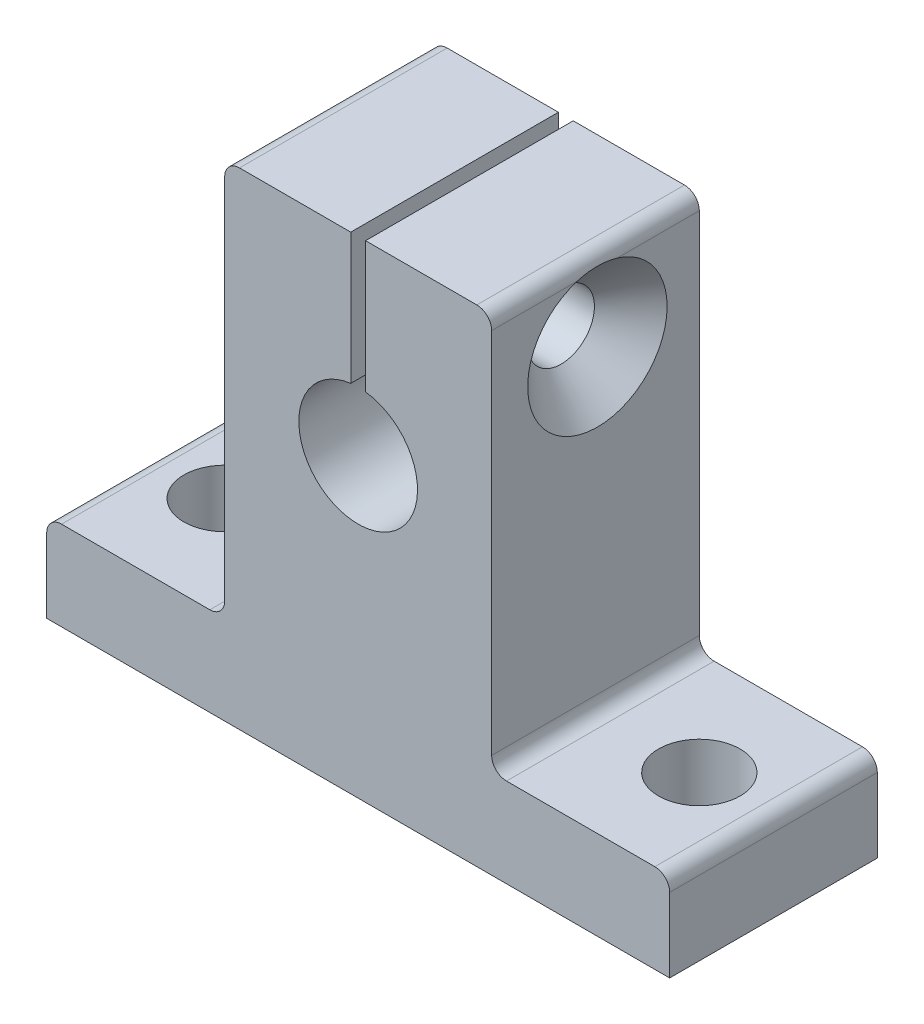
from build123d import *

# Parameters (mm, degrees)
BOSS_EXTRUDE1_DEPTH                             = 14
F_5_5_5_5_DIAMETER_HOLE1_D                      = 5.5
CSK_FOR_M4_FLAT_HEAD_MACHINE_SCREW1_D           = 4.5
CSK_FOR_M4_FLAT_HEAD_MACHINE_SCREW1_CSINK_D     = 9.4
CSK_FOR_M4_FLAT_HEAD_MACHINE_SCREW1_CSINK_ANGLE = 90
FILLET1_R                                       = 1


with BuildPart() as part:
    # Sketch1 → Boss-Extrude1 (new body)
    with BuildSketch(Plane.XY):
        with BuildLine():
            Line((-21, 0), (21, 0))
            Line((21, 0), (21, 6))
            Line((21, 6), (9, 6))
            Line((9, 6), (9, 32.8))
            Line((9, 32.8), (0.5, 32.8))
            Line((0.5, 32.8), (0.5, 23.968626967))
            ThreePointArc((0.5, 23.968626967), (0, 16), (-0.5, 23.968626967))
            Line((-0.5, 23.968626967), (-0.5, 32.8))
            Line((-0.5, 32.8), (-9, 32.8))
            Line((-9, 32.8), (-9, 6))
            Line((-9, 6), (-21, 6))
            Line((-21, 6), (-21, 0))
        make_face()
    extrude(amount=BOSS_EXTRUDE1_DEPTH)

    # Ø5.5 (5.5) Diameter Hole1 (through all)
    with Locations(Plane(origin=(-16, 6, 7), x_dir=(0, 0, 1), z_dir=(0, 1, 0))):
        with Locations((0, 0), (0, 32)):
            Hole(F_5_5_5_5_DIAMETER_HOLE1_D / 2)

    # CSK for M4 Flat Head Machine Screw1 (through all)
    with Locations(Plane(origin=(9, 27.3, 6.871372549), x_dir=(0, 1, 0), z_dir=(1, 0, 0))):
        with Locations((0, 0)):
            CounterSinkHole(CSK_FOR_M4_FLAT_HEAD_MACHINE_SCREW1_D / 2, CSK_FOR_M4_FLAT_HEAD_MACHINE_SCREW1_CSINK_D / 2, counter_sink_angle=CSK_FOR_M4_FLAT_HEAD_MACHINE_SCREW1_CSINK_ANGLE)

    # Fillet1
    # the kernel refuses this fillet: 1 mm, written as the material it adds along each edge
    with BuildSketch(Plane(origin=(-9, 6, 0), x_dir=(0, 1, 0), z_dir=(0, 0, 1)), Plane(origin=(9, 6, 0), x_dir=(1, 0, 0), z_dir=(0, 0, 1))) as fillet1_piece_1:
        with BuildLine():
            CenterArc((FILLET1_R, FILLET1_R), FILLET1_R, 180, 90)
            Line((0, FILLET1_R), (0, 0))
            Line((0, 0), (FILLET1_R, 0))
        make_face()
    extrude(amount=14)
    # the kernel refuses this fillet: 1 mm, written as the material it takes off along each edge
    with BuildSketch(Plane(origin=(-21, 6, -2.5), x_dir=(0, -1, 0), z_dir=(0, 0, 1))) as fillet1_2_piece_1:
        with BuildLine():
            CenterArc((FILLET1_R, FILLET1_R), FILLET1_R, 180, 90)
            Line((0, FILLET1_R), (0, 0))
            Line((0, 0), (FILLET1_R, 0))
        make_face()
    extrude(amount=19, mode=Mode.SUBTRACT)
    with BuildSketch(Plane(origin=(-9, 32.8, -2.5), x_dir=(1, 0, 0), z_dir=(0, 0, 1)), Plane(origin=(9, 32.8, -2.5), x_dir=(0, -1, 0), z_dir=(0, 0, 1)), Plane(origin=(21, 6, -2.5), x_dir=(0, -1, 0), z_dir=(0, 0, 1))) as fillet1_2_piece_2:
        with BuildLine():
            CenterArc((FILLET1_R, -FILLET1_R), FILLET1_R, 90, 90)
            Line((0, -FILLET1_R), (0, 0))
            Line((0, 0), (FILLET1_R, 0))
        make_face()
    extrude(amount=19, mode=Mode.SUBTRACT)


solid = part.part
